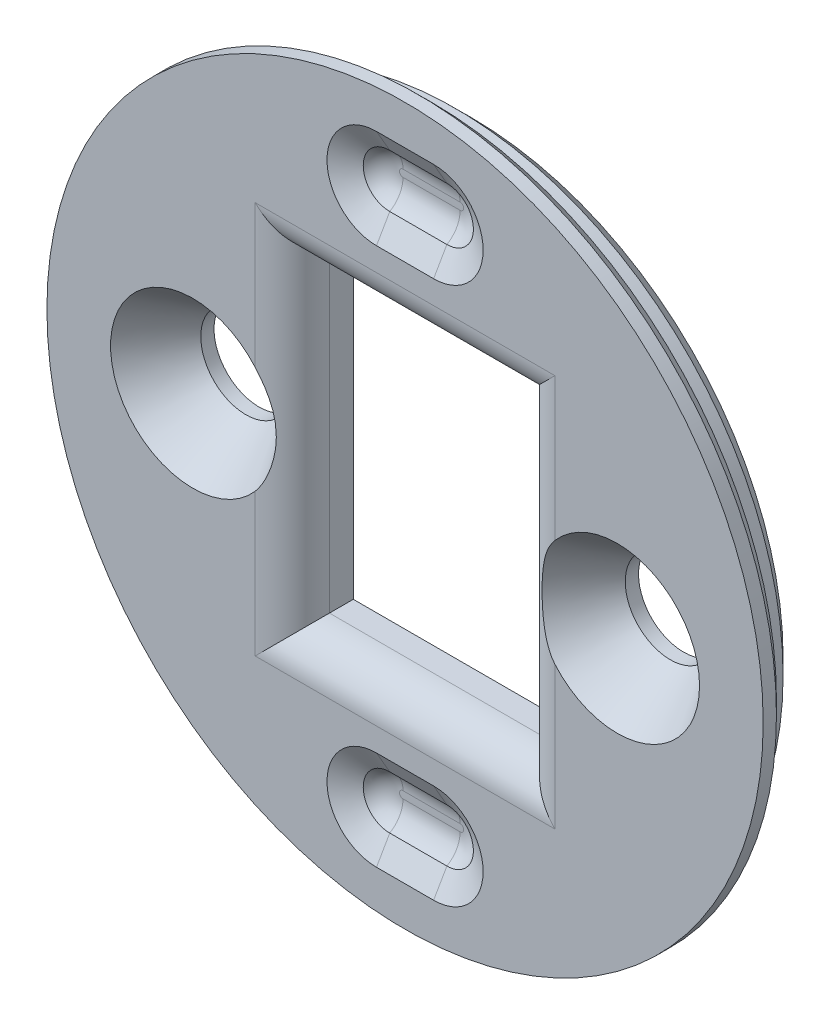
from build123d import *
from OCP.BRepFilletAPI import BRepFilletAPI_MakeChamfer

# Parameters (mm, degrees)
SKETCH1_R           = 12.35
SKETCH1_R_2         = 1.7
BOSS_EXTRUDE1_DEPTH = 1.5
BOSS_EXTRUDE3_START = 1
SKETCH3_R           = 13.5
SKETCH3_R_2         = 1.7
BOSS_EXTRUDE3_DEPTH = 1
CHAMFER2_SIZE       = 0.5
CHAMFER3_SIZE       = 2
CHAMFER3_SIZE2      = 1.400415076
SKETCH2_W           = 8.5
SKETCH2_H           = 12
CUT_EXTRUDE2_DEPTH  = 20.254869514
CHAMFER4_SIZE       = 0.2
CHAMFER5_SIZE       = 0.6
FILLET1_START       = -6
FILLET1_DEPTH       = 12
FILLET1_START_2     = -5.6500001
FILLET1_2_DEPTH     = 11.3000001
FILLET1_START_3     = -8
FILLET1_3_DEPTH     = 2
FILLET1_START_4     = 6
FILLET1_4_DEPTH     = 2
CUT_EXTRUDE3_DEPTH  = 1
FILLET2_R           = 1


with BuildPart() as part:
    # Sketch1 → Boss-Extrude1 (new body)
    with BuildSketch(Plane.XY):
        Circle(SKETCH1_R)
        with Locations((-8, 0)):
            Circle(SKETCH1_R_2, mode=Mode.SUBTRACT)
        with Locations(Location((8, 0, 0), (0, 0, 180))):
            Circle(SKETCH1_R_2, mode=Mode.SUBTRACT)
    extrude(amount=-BOSS_EXTRUDE1_DEPTH)

    # Sketch3 → Boss-Extrude3 (add)
    with BuildSketch(Plane.XY.offset(BOSS_EXTRUDE3_START)):
        Circle(SKETCH3_R)
        with Locations((-8, 0)):
            Circle(SKETCH3_R_2, mode=Mode.SUBTRACT)
        with Locations((8, 0)):
            Circle(SKETCH3_R_2, mode=Mode.SUBTRACT)
    extrude(amount=-BOSS_EXTRUDE3_DEPTH)

    # Chamfer2
    chamfer2_edges = [part.edges().sort_by_distance(p)[0] for p in [
        (-13.5, 0, 0),
    ]]
    chamfer(chamfer2_edges, length=CHAMFER2_SIZE)

    # Chamfer3: one chamfer whose edges measure the first distance from different faces: ONE call of the kernel's chamfer builder (chamfer() names one face for all edges)
    chamfer3_edges_1 = [part.edges().sort_by_distance(p)[0] for p in [
        (-9.7, 0, 1),
    ]]
    chamfer3_side_1 = [part.faces().sort_by_distance(p)[0] for p in [
        (-9.7, 0, -0.25),
    ]]
    chamfer3_edges_2 = [part.edges().sort_by_distance(p)[0] for p in [
        (6.3, 0, 1),
    ]]
    chamfer3_side_2 = [part.faces().sort_by_distance(p)[0] for p in [
        (8, -1.7, -0.25),
    ]]
    chamfer3 = BRepFilletAPI_MakeChamfer(part.part.solid().wrapped)
    for e in chamfer3_edges_1:
        chamfer3.Add(CHAMFER3_SIZE, CHAMFER3_SIZE2, e.wrapped, chamfer3_side_1[0].wrapped)  # the first distance lies on this face
    for e in chamfer3_edges_2:
        chamfer3.Add(CHAMFER3_SIZE, CHAMFER3_SIZE2, e.wrapped, chamfer3_side_2[0].wrapped)  # the first distance lies on this face
    add(Compound.cast(chamfer3.Shape()), mode=Mode.REPLACE)

    # Sketch2 → Cut-Extrude2 (cut, through all)
    with BuildSketch(Plane(origin=(0, 0, -1.5), x_dir=(-1, 0, 0), z_dir=(0, 0, -1))):
        Rectangle(SKETCH2_W, SKETCH2_H)
    extrude(amount=-CUT_EXTRUDE2_DEPTH, mode=Mode.SUBTRACT)

    # Chamfer4
    chamfer4_edges = [part.edges().sort_by_distance(p)[0] for p in [
        (-4.25, 0, -1.5),
        (0, 6, -1.5),
        (4.25, 0, -1.5),
        (0, -6, -1.5),
    ]]
    chamfer(chamfer4_edges, length=CHAMFER4_SIZE)

    # Chamfer5
    chamfer5_edges = [part.edges().sort_by_distance(p)[0] for p in [
        (-12.35, 0, -1.5),
    ]]
    chamfer(chamfer5_edges, length=CHAMFER5_SIZE)

    # Fillet1: read off the stored shape, not the designer's step
    # Fillet1 outline → Fillet1 (cut)
    with BuildSketch(Plane(origin=(0, 0, 0), x_dir=(1, 0, 0), z_dir=(0, 1, 0)).offset(FILLET1_START)):
        with BuildLine():
            Line((-5.65, -1), (-4.25, -1))
            Line((-4.25, -1), (-4.25, 0.4))
            ThreePointArc((-4.25, 0.4), (-4.660050506, -0.589949494), (-5.65, -1))
        make_face()
        with BuildLine():
            ThreePointArc((5.65, -1), (4.660050506, -0.589949494), (4.25, 0.4))
            Line((4.25, 0.4), (4.25, -1))
            Line((4.25, -1), (5.65, -1))
        make_face()
    extrude(amount=FILLET1_DEPTH, mode=Mode.SUBTRACT)

    # Fillet1 2 outline → Fillet1 2 (cut)
    with BuildSketch(Plane.YZ.offset(FILLET1_START_2)):
        with BuildLine():
            Line((7.4, 1), (6, 1))
            Line((6, 1), (6, -0.4))
            ThreePointArc((6, -0.4), (6.410050506, 0.589949494), (7.4, 1))
        make_face()
        with BuildLine():
            ThreePointArc((-7.4, 1), (-6.410050506, 0.589949494), (-6, -0.4))
            Line((-6, -0.4), (-6, 1))
            Line((-6, 1), (-7.4, 1))
        make_face()
    extrude(amount=FILLET1_2_DEPTH, mode=Mode.SUBTRACT)

    # Fillet1 3 outline → Fillet1 3 (add)
    with BuildSketch(Plane(origin=(0, 0, 0), x_dir=(1, 0, 0), z_dir=(0, 1, 0)).offset(FILLET1_START_3)):
        with BuildLine():
            ThreePointArc((4.25, 0.4), (4.660050506, -0.589949494), (5.65, -1))
            Line((5.65, -1), (5.65, 0.4))
            Line((5.65, 0.4), (4.25, 0.4))
        make_face()
        with BuildLine():
            Line((-5.6500001, 0.4), (-5.65, -1))
            ThreePointArc((-5.65, -1), (-4.660050506, -0.589949494), (-4.25, 0.4))
            Line((-4.25, 0.4), (-5.6500001, 0.4))
        make_face()
    extrude(amount=FILLET1_3_DEPTH)

    # Fillet1 4 outline → Fillet1 4 (add)
    with BuildSketch(Plane(origin=(0, 0, 0), x_dir=(1, 0, 0), z_dir=(0, 1, 0)).offset(FILLET1_START_4)):
        with BuildLine():
            ThreePointArc((4.25, 0.4), (4.660050506, -0.589949494), (5.65, -1))
            Line((5.65, -1), (5.65, 0.4))
            Line((5.65, 0.4), (4.25, 0.4))
        make_face()
        with BuildLine():
            Line((-5.6500001, 0.4), (-5.65, -1))
            ThreePointArc((-5.65, -1), (-4.660050506, -0.589949494), (-4.25, 0.4))
            Line((-4.25, 0.4), (-5.6500001, 0.4))
        make_face()
    extrude(amount=FILLET1_4_DEPTH)

    # Sketch4 → Cut-Extrude3 (cut)
    with BuildSketch(Plane.XY.offset(1)):
        with BuildLine():
            Line((-1.07681329, 11.278202352), (1.07681329, 11.278202352))
            ThreePointArc((1.07681329, 11.278202352), (2.210300963, 10.144714678), (1.07681329, 9.011227005))
            Line((1.07681329, 9.011227005), (-1.07681329, 9.011227005))
            ThreePointArc((-1.07681329, 9.011227005), (-2.210300963, 10.144714678), (-1.07681329, 11.278202352))
        make_face()
        with BuildLine():
            Line((-1.07681329, -11.278202352), (1.07681329, -11.278202352))
            ThreePointArc((1.07681329, -11.278202352), (2.210300963, -10.144714678), (1.07681329, -9.011227005))
            Line((1.07681329, -9.011227005), (-1.07681329, -9.011227005))
            ThreePointArc((-1.07681329, -9.011227005), (-2.210300963, -10.144714678), (-1.07681329, -11.278202352))
        make_face()
    extrude(amount=-CUT_EXTRUDE3_DEPTH, mode=Mode.SUBTRACT)

    # Fillet2
    fillet2_edges = [part.edges().sort_by_distance(p)[0] for p in [
        (2.210300963, -10.144714678, 0),
        (0, -11.278202352, 0),
        (-2.210300963, -10.144714678, 0),
        (0, -9.011227005, 0),
        (2.210300963, 10.144714678, 0),
        (0, 9.011227005, 0),
        (-2.210300963, 10.144714678, 0),
        (0, 11.278202352, 0),
    ]]
    fillet(fillet2_edges, radius=FILLET2_R - 0.0001)  # a hair under: the kernel refuses the full size

    # Chamfer6: read off the stored shape, not the designer's step
    # Chamfer6: loft between two sections, ruled curve by curve
    chamfer6_from = [
        Edge.make_three_point_arc((-1.07681329, 11.144227755, 0.5), (-1.783575765, 10.851477153, 0.5), (-2.076326367, 10.144714678, 0.5)),
        Edge.make_three_point_arc((-2.076326367, 10.144714678, 0.5), (-1.783575765, 9.437952203, 0.5), (-1.07681329, 9.145201601, 0.5)),
        Edge.make_three_point_arc((1.07681329, 9.145201601, 0.5), (1.783575765, 9.437952203, 0.5), (2.076326367, 10.144714678, 0.5)),
        Edge.make_three_point_arc((2.076326367, 10.144714678, 0.5), (1.783575765, 10.851477153, 0.5), (1.07681329, 11.144227755, 0.5)),
        Edge.make_line((1.07681329, 11.144227755, 0.5), (-1.07681329, 11.144227755, 0.5)),
        Edge.make_line((-1.07681329, 9.145201601, 0.5), (1.07681329, 9.145201601, 0.5)),
    ]
    chamfer6_to = [
        Edge.make_three_point_arc((-1.07681329, 12.010253159, 1), (-2.3959482, 11.463849589, 1), (-2.942351771, 10.144714678, 1)),
        Edge.make_three_point_arc((-2.942351771, 10.144714678, 1), (-2.3959482, 8.825579768, 1), (-1.07681329, 8.279176197, 1)),
        Edge.make_three_point_arc((1.07681329, 8.279176197, 1), (2.3959482, 8.825579768, 1), (2.942351771, 10.144714678, 1)),
        Edge.make_three_point_arc((2.942351771, 10.144714678, 1), (2.3959482, 11.463849589, 1), (1.07681329, 12.010253159, 1)),
        Edge.make_line((1.07681329, 12.010253159, 1), (-1.07681329, 12.010253159, 1)),
        Edge.make_line((-1.07681329, 8.279176197, 1), (1.07681329, 8.279176197, 1)),
    ]
    chamfer6 = Solid(Shell([*[Face.make_surface_from_curves(chamfer6_from[k], chamfer6_to[k]) for k in range(6)], Face(Wire(chamfer6_from)), Face(Wire(chamfer6_to))]))
    add(chamfer6, mode=Mode.SUBTRACT)

    # Chamfer6 2: loft between two sections, ruled curve by curve
    chamfer6_2_from = [
        Edge.make_three_point_arc((-1.07681329, -9.145201601, 0.5), (-1.783575765, -9.437952203, 0.5), (-2.076326367, -10.144714678, 0.5)),
        Edge.make_three_point_arc((-2.076326367, -10.144714678, 0.5), (-1.783575765, -10.851477153, 0.5), (-1.07681329, -11.144227755, 0.5)),
        Edge.make_three_point_arc((1.07681329, -11.144227755, 0.5), (1.783575765, -10.851477153, 0.5), (2.076326367, -10.144714678, 0.5)),
        Edge.make_three_point_arc((2.076326367, -10.144714678, 0.5), (1.783575765, -9.437952203, 0.5), (1.07681329, -9.145201601, 0.5)),
        Edge.make_line((1.07681329, -9.145201601, 0.5), (-1.07681329, -9.145201601, 0.5)),
        Edge.make_line((-1.07681329, -11.144227755, 0.5), (1.07681329, -11.144227755, 0.5)),
    ]
    chamfer6_2_to = [
        Edge.make_three_point_arc((-1.07681329, -8.279176197, 1), (-2.3959482, -8.825579768, 1), (-2.942351771, -10.144714678, 1)),
        Edge.make_three_point_arc((-2.942351771, -10.144714678, 1), (-2.3959482, -11.463849589, 1), (-1.07681329, -12.010253159, 1)),
        Edge.make_three_point_arc((1.07681329, -12.010253159, 1), (2.3959482, -11.463849589, 1), (2.942351771, -10.144714678, 1)),
        Edge.make_three_point_arc((2.942351771, -10.144714678, 1), (2.3959482, -8.825579768, 1), (1.07681329, -8.279176197, 1)),
        Edge.make_line((1.07681329, -8.279176197, 1), (-1.07681329, -8.279176197, 1)),
        Edge.make_line((-1.07681329, -12.010253159, 1), (1.07681329, -12.010253159, 1)),
    ]
    chamfer6_2 = Solid(Shell([*[Face.make_surface_from_curves(chamfer6_2_from[k], chamfer6_2_to[k]) for k in range(6)], Face(Wire(chamfer6_2_from)), Face(Wire(chamfer6_2_to))]))
    add(chamfer6_2, mode=Mode.SUBTRACT)


solid = part.part
